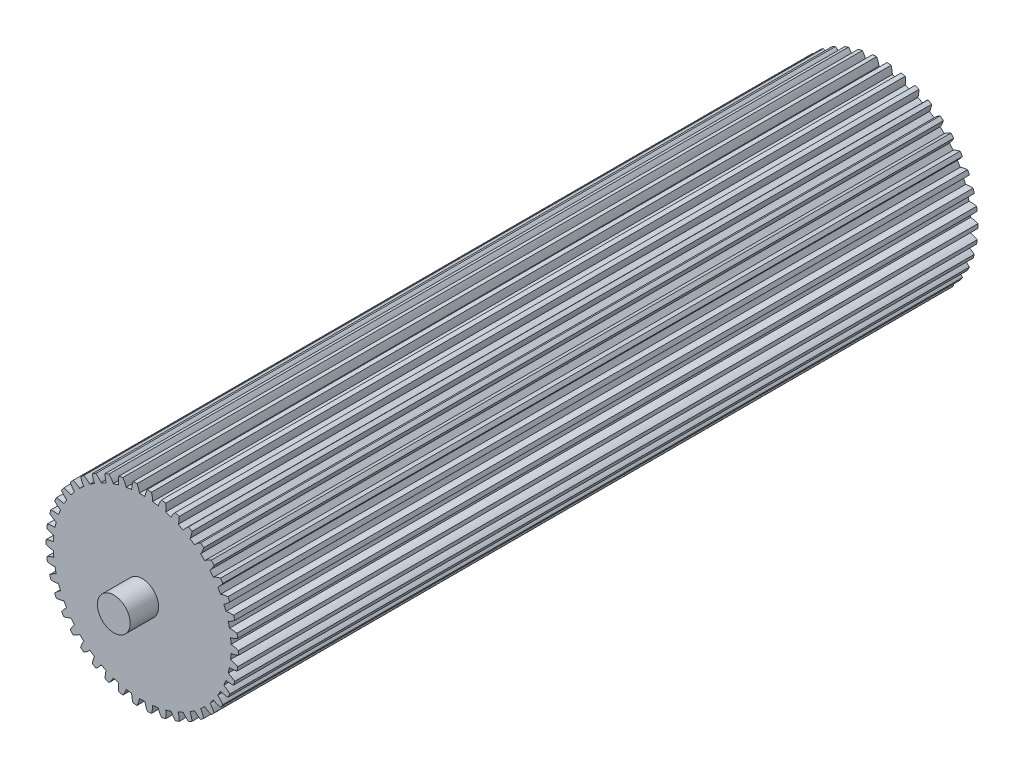
from build123d import *

# Parameters (mm, degrees)
SKETCH1_R           = 18.626666667
BOSS_EXTRUDE1_DEPTH = 143.2
CUT_EXTRUDE2_DEPTH  = 144.2
CIRPATTERN1_COUNT   = 42
SKETCH3_R           = 3.175
BOSS_EXTRUDE2_DEPTH = 8
BOSS_EXTRUDE3_START = 148.7
SKETCH4_R           = 3.175
BOSS_EXTRUDE3_DEPTH = 5.5


with BuildPart() as part:
    # Sketch1 → Boss-Extrude1 (new body)
    with BuildSketch(Plane.XY):
        Circle(SKETCH1_R)
    extrude(amount=BOSS_EXTRUDE1_DEPTH)

    # Sketch2 → Cut-Extrude2 (cut, symmetric)
    with BuildSketch(Plane.XY):
        with BuildLine():
            add(Edge.make_bspline(
                [(17.197794317, 0.739009432), (17.203892696, 0.739218074), (17.21543595, 0.73930356), (17.234290481, 0.73910886), (17.271535049, 0.737867759), (17.313692039, 0.735293434), (17.361379443, 0.731228124), (17.412709302, 0.725698856), (17.45664549, 0.720250412), (17.500520881, 0.714143297), (17.54427023, 0.70745302), (17.597315869, 0.698630803), (17.66099398, 0.687053386), (17.735530693, 0.672062459), (17.820194333, 0.653336786), (17.906624473, 0.632403089), (17.991790805, 0.610283496), (18.077983339, 0.586179627), (18.161481204, 0.561614407), (18.248366585, 0.534292881), (18.328644137, 0.508156476), (18.418766174, 0.476867684), (18.491547283, 0.451032541), (18.566887923, 0.422665763), (18.603580461, 0.408611376), (18.622342766, 0.401324063)],
                knots=[0, 0, 0, 0, 0, 0.015083688, 0.02853182, 0.04661014, 0.092110526, 0.119476176, 0.146842496, 0.174208854, 0.201574956, 0.228941013, 0.256307345, 0.307035032, 0.361767352, 0.416499661, 0.471231937, 0.525964282, 0.580696616, 0.635428982, 0.690161387, 0.744893688, 0.799626082, 0.854358407, 0.909090914, 0.909090914, 0.909090914, 0.909090914, 0.909090914], degree=4))
            Line((18.622342766, 0.401324063), (59.986071903, 1.29274036))
            add(Edge.make_bspline(
                [(59.986071903, 1.29274036), (59.984705998, 1.356121459), (59.981788512, 1.47956213), (59.973929675, 1.790524821), (59.96571531, 2.028377944), (59.95367575, 2.372260269), (59.94146295, 2.652288961), (59.926888549, 2.970752343), (59.911256555, 3.265919581), (59.893811207, 3.574911958), (59.874955933, 3.875648951), (59.85453816, 4.180793709), (59.83250074, 4.483826067), (59.809127391, 4.786758311), (59.783837648, 5.091537965), (59.757659801, 5.391726207), (59.728857375, 5.699867489), (59.700322379, 5.99406778), (59.667269491, 6.311146391), (59.637609774, 6.589867618), (59.598261861, 6.931703464), (59.570934309, 7.168124252), (59.532358786, 7.476785046), (59.516845808, 7.599281815), (59.508749995, 7.662158577)],
                knots=[0.083333333, 0.083333333, 0.083333333, 0.083333333, 0.083333333, 0.123015873, 0.162698413, 0.202380952, 0.242063492, 0.281746032, 0.321428571, 0.361111111, 0.400793651, 0.44047619, 0.48015873, 0.51984127, 0.55952381, 0.599206349, 0.638888889, 0.678571429, 0.718253968, 0.757936508, 0.797619048, 0.837301587, 0.876984127, 0.916666667, 0.916666667, 0.916666667, 0.916666667, 0.916666667], degree=4))
            Line((59.508749995, 7.662158577), (18.474160832, 2.378674563))
            add(Edge.make_bspline(
                [(17.115852804, 1.832442931), (17.121914166, 1.833145535), (17.133341232, 1.834781437), (17.151956155, 1.837784085), (17.188599755, 1.844562338), (17.229902204, 1.853391084), (17.276451075, 1.864518426), (17.326383528, 1.877636255), (17.369016937, 1.889572194), (17.411492058, 1.902150385), (17.453755628, 1.915286439), (17.504893908, 1.931916162), (17.566135263, 1.952854998), (17.63760518, 1.978787609), (17.718532281, 2.009922593), (17.800877062, 2.043504222), (17.881795402, 2.07807014), (17.963432742, 2.11475112), (18.042336749, 2.151486678), (18.124179629, 2.191452639), (18.199665119, 2.22926187), (18.284117214, 2.273633185), (18.35223489, 2.310027232), (18.422506189, 2.349306116), (18.456694203, 2.368672266), (18.474160832, 2.378674563)],
                knots=[0, 0, 0, 0, 0, 0.015083688, 0.02853182, 0.04661014, 0.092110526, 0.119476176, 0.146842496, 0.174208854, 0.201574956, 0.228941013, 0.256307345, 0.307035032, 0.361767352, 0.416499661, 0.471231937, 0.525964282, 0.580696616, 0.635428982, 0.690161387, 0.744893688, 0.799626082, 0.854358407, 0.909090914, 0.909090914, 0.909090914, 0.909090914, 0.909090914], degree=4))
            Line((17.115852804, 1.832442931), (17.197794317, 0.739009432))
        make_face()
    cut_extrude2 = extrude(amount=CUT_EXTRUDE2_DEPTH, both=True, mode=Mode.SUBTRACT)

    # CirPattern1: Cut-Extrude2 ×42 about axis
    cirpattern1_axis = Axis((0, 0, -15.835), (0, 0, 1))
    for i in range(1, CIRPATTERN1_COUNT):
        add(cut_extrude2.rotate(cirpattern1_axis, i * 360 / CIRPATTERN1_COUNT), mode=Mode.SUBTRACT)

    # Sketch3 → Boss-Extrude2 (add)
    with BuildSketch(Plane.XY):
        Circle(SKETCH3_R)
    extrude(amount=-BOSS_EXTRUDE2_DEPTH)

    # Sketch4 → Boss-Extrude3 (add)
    with BuildSketch(Plane.XY.offset(BOSS_EXTRUDE3_START)):
        Circle(SKETCH4_R)
    extrude(amount=-BOSS_EXTRUDE3_DEPTH)


solid = part.part
